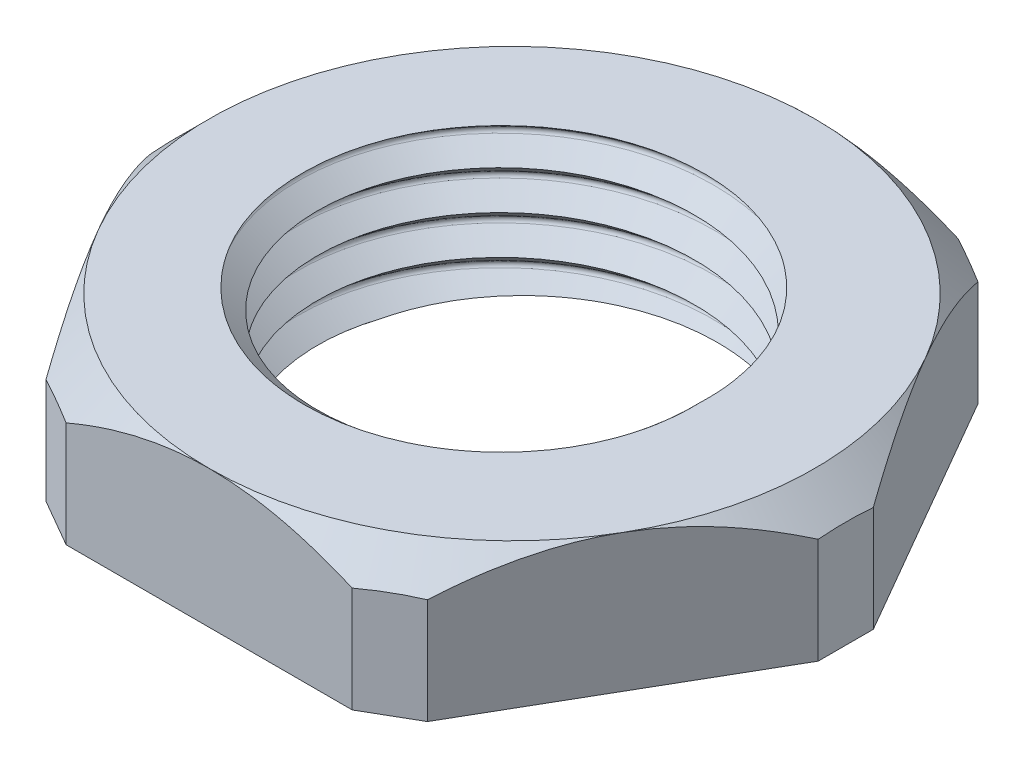
from build123d import *

# Parameters (mm, degrees)
PROFILE_DEPTH               = 2.5
MINORDIAREF_R               = 6.843296056
THRUHOLE_DEPTH              = 18.530925056
LOCKNUTTHREAD_PITCH         = 1.411
TOPCHAMFERS_OUTSIDE_W       = 71.26
TOPCHAMFERS_OUTSIDE_H       = 67.856
TOPCHAMFERS_OUTSIDE_R       = 11
TOPCHAMFER_DEPTH            = 18.53092522
TOPCHAMFER_DRAFT            = -45
CORNERFLAT_DEPTH            = 17.987740832
CIRPATTERN1_COUNT           = 6
EJECTIONPINHOLES_R          = 0.7
EJECTIONPINHOLE_DEPTH       = 1
EJECTIONPINHOLE_DRAFT       = -5
CIRPATTERN2_COPY_1_SKETCH_R = 0.7
CIRPATTERN2_COPY_1_DEPTH    = 1
CIRPATTERN2_COPY_1_DRAFT    = -5
CIRPATTERN2_COPY_2_SKETCH_R = 0.7
CIRPATTERN2_COPY_2_DEPTH    = 1
CIRPATTERN2_COPY_2_DRAFT    = -5


with BuildPart() as part:
    # ProfileS → Profile (new, symmetric)
    with BuildSketch(Plane(origin=(0, 0, 0), x_dir=(1, 0, 0), z_dir=(0, 1, 0))):
        Polygon((6.350852961, -11), (12.701705922, 0), (6.350852961, 11), (-6.350852961, 11), (-12.701705922, 0), (-6.350852961, -11), align=None)
    extrude(amount=PROFILE_DEPTH, both=True)

    # MinorDiaRef → ThruHole (cut, through all)
    with BuildSketch(Plane(origin=(0, 2.5, 0), x_dir=(-1, 0, 0), z_dir=(0, 1, 0))):
        with Locations(Location((0, 0, 0), (0, 0, 90))):
            Circle(MINORDIAREF_R)
    extrude(amount=-THRUHOLE_DEPTH, mode=Mode.SUBTRACT)

    # LockNutThread: arcs per turn and ends read off the stored shape
    # LockNutThread: the profile of LockNutThreadProfile screwed along a right-hand helix through 6 turns, 8 arcs to a turn; built about Z, then put on its axis
    locknutthread_z = Axis((0, 0, 0), (0, 0, 1))
    locknutthread_corners = [(6.843296056, 0, -2.1165), (7.546245845, 0, -1.526655092), (7.6001767, 0, -1.411), (7.546245845, 0, -1.295344908), (6.843296056, 0, -0.7055), (6.75921784, 0, -0.63495), (6.75921784, 0, -2.18705)]
    with BuildLine(mode=Mode.PRIVATE) as locknutthread_profile:
        Line(locknutthread_corners[0], locknutthread_corners[1])
        Line(locknutthread_corners[3], locknutthread_corners[4])
        Line(locknutthread_corners[4], locknutthread_corners[5])
        Line(locknutthread_corners[5], locknutthread_corners[6])
        Line(locknutthread_corners[6], locknutthread_corners[0])
        ThreePointArc((7.546245845, 0, -1.526655092), (7.586031331, 0, -1.474805637), (7.6001767, 0, -1.411))
        ThreePointArc((7.6001767, 0, -1.411), (7.586031331, 0, -1.347194363), (7.546245845, 0, -1.295344908))
    locknutthread_cap = Face(locknutthread_profile.wire())
    locknutthread_arcs = [((7.546245845, 0, -1.526655092), (7.6001767, 0, -1.481401731), (7.6001767, 0, -1.411), (1, 0.9063077870366513, 1)), ((7.6001767, 0, -1.411), (7.6001767, 0, -1.340598269), (7.546245845, 0, -1.295344908), (1, 0.9063077870366513, 1))]  # start, shoulder, end, weights
    locknutthread_turn_angles = [0, 22.5, 45, 67.5, 90, 112.5, 135, 157.5, 180, 202.5, 225, 247.5, 270, 292.5, 315, 337.5, 360]
    locknutthread_turn_weights = [1, 0.9238795325112867, 1, 0.9238795325112867, 1, 0.9238795325112867, 1, 0.9238795325112867, 1, 0.9238795325112867, 1, 0.9238795325112867, 1, 0.9238795325112867, 1, 0.9238795325112867, 1]
    locknutthread_turn_rails = [Edge.make_bspline([Vector(p[0], p[1], 0).rotate(locknutthread_z, locknutthread_turn_angles[k]) / locknutthread_turn_weights[k] + Vector(0, 0, p[2] + LOCKNUTTHREAD_PITCH * locknutthread_turn_angles[k] / 360) for k in range(17)], [0, 0, 0, 1, 1, 2, 2, 3, 3, 4, 4, 5, 5, 6, 6, 7, 7, 8, 8, 8], 2, locknutthread_turn_weights) for p in locknutthread_corners]
    locknutthread_turn_sides = [*[Face.make_surface_from_curves(locknutthread_turn_rails[p[0]], locknutthread_turn_rails[p[1]]) for p in [(0, 1), (3, 4), (4, 5), (5, 6), (6, 0)]], *[Face.make_bezier_surface([[Vector(p[j][0], p[j][1], 0).rotate(locknutthread_z, locknutthread_turn_angles[2 * i + k]) / locknutthread_turn_weights[2 * i + k] + Vector(0, 0, p[j][2] + LOCKNUTTHREAD_PITCH * locknutthread_turn_angles[2 * i + k] / 360) for k in range(3)] for j in range(3)], [[p[3][j] * locknutthread_turn_weights[2 * i + k] for k in range(3)] for j in range(3)]) for p in locknutthread_arcs for i in range(8)]]
    locknutthread_turn = Solid(Shell([*locknutthread_turn_sides, locknutthread_cap, locknutthread_cap.rotate(locknutthread_z, 360).moved(Location((0, 0, LOCKNUTTHREAD_PITCH * 360 / 360)))]))
    locknutthread_each = [*[locknutthread_turn.moved(Location((0, 0, LOCKNUTTHREAD_PITCH * i))) for i in range(6)]]
    add(Plane(origin=(0, 2.5, 0), x_dir=(-1, 0, 0), z_dir=(0, -1, 0)) * Compound([locknutthread_each[i] for i in range(0, 6, 2)]), mode=Mode.SUBTRACT)
    add(Plane(origin=(0, 2.5, 0), x_dir=(-1, 0, 0), z_dir=(0, -1, 0)) * Compound([locknutthread_each[i] for i in range(1, 6, 2)]), mode=Mode.SUBTRACT)


with BuildPart() as topchamfer_tool:
    # TopChamferS outside → TopChamfer (with draft: the straight prism first)
    with BuildSketch(Plane(origin=(0, 2.5, 0), x_dir=(1, 0, 0), z_dir=(0, 1, 0))):
        Rectangle(TOPCHAMFERS_OUTSIDE_W, TOPCHAMFERS_OUTSIDE_H)
        Circle(TOPCHAMFERS_OUTSIDE_R, mode=Mode.SUBTRACT)
    extrude(amount=-TOPCHAMFER_DEPTH)
    # TopChamfer: the draft: its side faces are tilted about the plane it starts from
    topchamfer_sides = [topchamfer_tool.faces().sort_by_distance(p)[0] for p in [
        (0, -6.76546261, 33.928),
        (35.63, -6.76546261, 0),
        (0, -6.76546261, -33.928),
        (-35.63, -6.76546261, 0),
        (-11, -6.76546261, 0),
    ]]
    draft(topchamfer_sides, Plane(origin=(0, 2.5, 0), x_dir=(1, 0, 0), z_dir=(0, 1, 0)), TOPCHAMFER_DRAFT)


with BuildPart() as part_1:
    add(part.part)

    # TopChamfer: cut by topchamfer_tool
    add(topchamfer_tool.part, mode=Mode.SUBTRACT)

    # CornerFlatS → CornerFlat (cut, symmetric)
    with BuildSketch(Plane(origin=(0, 0, 0), x_dir=(1, 0, 0), z_dir=(0, 1, 0))):
        Polygon((53.253658998, 44.746014358), (-5.196152423, 11), (-6.92820323, 10), (-65.378014651, -23.746014358), (-132.870043367, 93.153608484), (-14.238369718, 161.645637199), align=None)
    cornerflat = extrude(amount=CORNERFLAT_DEPTH, both=True, mode=Mode.SUBTRACT)

    # CirPattern1: CornerFlat ×6 about axis
    cirpattern1_axis = Axis((0, 0, 0), (0, 1, 0))
    for i in range(1, CIRPATTERN1_COUNT):
        add(cornerflat.rotate(cirpattern1_axis, i * 360 / CIRPATTERN1_COUNT), mode=Mode.SUBTRACT)


with BuildPart() as ejectionpinhole_tool:
    # EjectionPinHoleS → EjectionPinHole (with draft: the straight prism first)
    with BuildSketch(Plane(origin=(0, -2.5, 0), x_dir=(-1, 0, 0), z_dir=(0, -1, 0))):
        with Locations((4.931088913, -8.540896534)):
            Circle(EJECTIONPINHOLES_R)
    extrude(amount=-EJECTIONPINHOLE_DEPTH)
    # EjectionPinHole: the draft: its side faces are tilted about the plane it starts from
    ejectionpinhole_sides = [ejectionpinhole_tool.faces().sort_by_distance(p)[0] for p in [
        (-4.231088913, -2, 8.540896534),
    ]]
    draft(ejectionpinhole_sides, Plane(origin=(0, -2.5, 0), x_dir=(-1, 0, 0), z_dir=(0, -1, 0)), EJECTIONPINHOLE_DRAFT)


with BuildPart() as part_2:
    add(part_1.part)

    # EjectionPinHole: cut by ejectionpinhole_tool
    add(ejectionpinhole_tool.part, mode=Mode.SUBTRACT)


with BuildPart() as cirpattern2_copy_1_tool:
    # CirPattern2 copy 1 sketch → CirPattern2 copy 1 (with draft: the straight prism first)
    with BuildSketch(Plane(origin=(0, -2.5, 0), x_dir=(0.4999999999999998, 0, 0.8660254037844387), z_dir=(0, -1, 0))):
        with Locations((4.931088913, -8.540896534)):
            Circle(CIRPATTERN2_COPY_1_SKETCH_R)
    extrude(amount=-CIRPATTERN2_COPY_1_DEPTH)
    # CirPattern2 copy 1: the draft: its side faces are tilted about the plane it starts from
    cirpattern2_copy_1_sides = [cirpattern2_copy_1_tool.faces().sort_by_distance(p)[0] for p in [
        (9.512177826, -2, -0.606217783),
    ]]
    draft(cirpattern2_copy_1_sides, Plane(origin=(0, -2.5, 0), x_dir=(0.4999999999999998, 0, 0.8660254037844387), z_dir=(0, -1, 0)), CIRPATTERN2_COPY_1_DRAFT)


with BuildPart() as part_3:
    add(part_2.part)

    # CirPattern2 copy 1: cut by cirpattern2_copy_1_tool
    add(cirpattern2_copy_1_tool.part, mode=Mode.SUBTRACT)


with BuildPart() as cirpattern2_copy_2_tool:
    # CirPattern2 copy 2 sketch → CirPattern2 copy 2 (with draft: the straight prism first)
    with BuildSketch(Plane(origin=(0, -2.5, 0), x_dir=(0.5000000000000004, 0, -0.8660254037844384), z_dir=(0, -1, 0))):
        with Locations((4.931088913, -8.540896534)):
            Circle(CIRPATTERN2_COPY_2_SKETCH_R)
    extrude(amount=-CIRPATTERN2_COPY_2_DEPTH)
    # CirPattern2 copy 2: the draft: its side faces are tilted about the plane it starts from
    cirpattern2_copy_2_sides = [cirpattern2_copy_2_tool.faces().sort_by_distance(p)[0] for p in [
        (-5.281088913, -2, -7.934678751),
    ]]
    draft(cirpattern2_copy_2_sides, Plane(origin=(0, -2.5, 0), x_dir=(0.5000000000000004, 0, -0.8660254037844384), z_dir=(0, -1, 0)), CIRPATTERN2_COPY_2_DRAFT)


with BuildPart() as part_4:
    add(part_3.part)

    # CirPattern2 copy 2: cut by cirpattern2_copy_2_tool
    add(cirpattern2_copy_2_tool.part, mode=Mode.SUBTRACT)


solid = part_4.part
